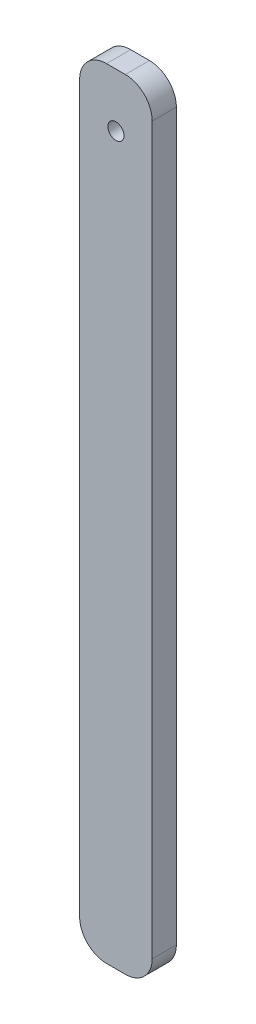
from build123d import *

# Parameters (mm, degrees)
SKETCH1_R           = 3
BOSS_EXTRUDE1_DEPTH = 9


with BuildPart() as part:
    # Sketch1 → Boss-Extrude1 (new body)
    with BuildSketch(Plane.XY):
        with BuildLine():
            ThreePointArc((-13.5, -135), (-10.571067812, -142.071067812), (-3.5, -145))
            Line((-3.5, -145), (3.5, -145))
            ThreePointArc((3.5, -145), (10.571067812, -142.071067812), (13.5, -135))
            Line((13.5, -135), (13.5, 135))
            ThreePointArc((13.5, 135), (10.571067812, 142.071067812), (3.5, 145))
            Line((3.5, 145), (-3.5, 145))
            ThreePointArc((-3.5, 145), (-10.571067812, 142.071067812), (-13.5, 135))
            Line((-13.5, 135), (-13.5, -135))
        make_face()
        with Locations((0, 125)):
            Circle(SKETCH1_R, mode=Mode.SUBTRACT)
    extrude(amount=BOSS_EXTRUDE1_DEPTH)


solid = part.part
